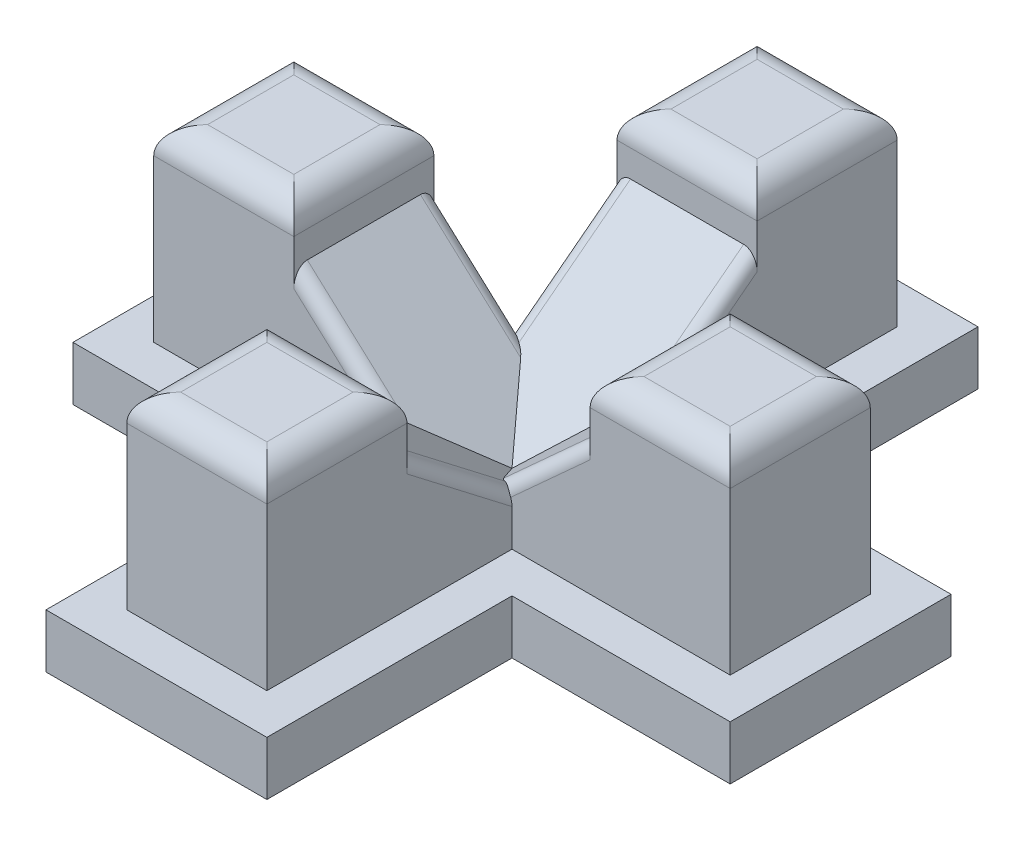
from build123d import *

# Parameters (mm, degrees)
BOSS_EXTRUDE1_DEPTH = 2
SKETCH4_W           = 5.2
SKETCH4_H           = 5.2
BOSS_EXTRUDE3_DEPTH = 7
FILLET6_R           = 1
BOSS_EXTRUDE4_DEPTH = 5.2
BOSS_EXTRUDE5_DEPTH = 5.2
BOSS_EXTRUDE6_DEPTH = 5.2
BOSS_EXTRUDE7_DEPTH = 5.2
FILLET7_R           = 0.5


with BuildPart() as part:
    # Sketch1 → Boss-Extrude1 (new body)
    with BuildSketch(Plane(origin=(0, 0, 0), x_dir=(1, 0, 0), z_dir=(0, 1, 0))):
        Polygon((-4.1, 13.2), (-4.1, 4.1), (-12.2, 4.1), (-12.2, -4.1), (-4.1, -4.1), (-4.1, -13.2), (4.1, -13.2), (4.1, -4.1), (12.2, -4.1), (12.2, 4.1), (4.1, 4.1), (4.1, 13.2), align=None)
    extrude(amount=BOSS_EXTRUDE1_DEPTH)

    # Sketch4 → Boss-Extrude3 (add)
    with BuildSketch(Plane(origin=(0, 2, 0), x_dir=(1, 0, 0), z_dir=(0, 1, 0))):
        with Locations((8.1, 0)):
            Rectangle(SKETCH4_W, SKETCH4_H)
        with Locations((0, -9.1)):
            Rectangle(SKETCH4_W, SKETCH4_H)
        with Locations((0, 9.1)):
            Rectangle(SKETCH4_W, SKETCH4_H)
        with Locations((-8.1, 0)):
            Rectangle(SKETCH4_W, SKETCH4_H)
    extrude(amount=BOSS_EXTRUDE3_DEPTH)

    # Fillet6
    fillet6_edges = [part.edges().sort_by_distance(p)[0] for p in [
        (-2.6, 9, -9.1),
        (0, 9, -11.7),
        (2.6, 9, -9.1),
        (0, 9, -6.5),
        (-5.5, 9, 0),
        (-8.1, 9, 2.6),
        (-10.7, 9, 0),
        (-8.1, 9, -2.6),
        (-2.6, 9, 9.1),
        (0, 9, 6.5),
        (2.6, 9, 9.1),
        (0, 9, 11.7),
        (8.1, 9, 2.6),
        (5.5, 9, 0),
        (10.7, 9, 0),
        (8.1, 9, -2.6),
    ]]
    fillet(fillet6_edges, radius=FILLET6_R)

    # Sketch5 → Boss-Extrude4 (add)
    with BuildSketch(Plane(origin=(0, 0, -2.6), x_dir=(-1, 0, 0), z_dir=(0, 0, -1))):
        Polygon((-5.5, 2), (-5.5, 6.997947642), (0, 2), align=None)
    extrude(amount=-BOSS_EXTRUDE4_DEPTH)

    # Sketch6 → Boss-Extrude5 (add)
    with BuildSketch(Plane(origin=(2.6, 0, 0), x_dir=(0, 0, -1), z_dir=(1, 0, 0))):
        Polygon((6.5, 2), (6.5, 7), (0, 2), align=None)
    extrude(amount=-BOSS_EXTRUDE5_DEPTH)

    # Sketch7 → Boss-Extrude6 (add)
    with BuildSketch(Plane(origin=(0, 0, -2.6), x_dir=(-1, 0, 0), z_dir=(0, 0, -1))):
        Polygon((5.5, 2), (5.5, 7), (0, 2), align=None)
    extrude(amount=-BOSS_EXTRUDE6_DEPTH)

    # Sketch8 → Boss-Extrude7 (add)
    with BuildSketch(Plane.ZY.offset(2.6)):
        Polygon((6.5, 2), (6.5, 7), (0, 2), align=None)
    extrude(amount=-BOSS_EXTRUDE7_DEPTH)

    # Fillet7
    fillet7_edges = [part.edges().sort_by_distance(p)[0] for p in [
        (2.6, 5.5, 4.55),
    ]]
    fillet(fillet7_edges, radius=FILLET7_R)
    fillet7_2_edges = [part.edges().sort_by_distance(p)[0] for p in [
        (-2.6, 5.5, 4.55),
    ]]
    fillet(fillet7_2_edges, radius=FILLET7_R)
    fillet7_3_edges = [part.edges().sort_by_distance(p)[0] for p in [
        (3.850451704, 5.498973821, -2.6),
    ]]
    fillet(fillet7_3_edges, radius=FILLET7_R)
    fillet7_4_edges = [part.edges().sort_by_distance(p)[0] for p in [
        (3.844826513, 5.49386211, 2.6),
    ]]
    fillet(fillet7_4_edges, radius=FILLET7_R)
    fillet7_5_edges = [part.edges().sort_by_distance(p)[0] for p in [
        (2.6, 5.482875985, -4.527738781),
    ]]
    fillet(fillet7_5_edges, radius=FILLET7_R)
    fillet7_6_edges = [part.edges().sort_by_distance(p)[0] for p in [
        (-2.6, 5.5, -4.55),
    ]]
    fillet(fillet7_6_edges, radius=FILLET7_R)
    fillet7_7_edges = [part.edges().sort_by_distance(p)[0] for p in [
        (-3.844467541, 5.494970492, -2.6),
    ]]
    fillet(fillet7_7_edges, radius=FILLET7_R)
    fillet7_8_edges = [part.edges().sort_by_distance(p)[0] for p in [
        (-3.844467541, 5.494970492, 2.6),
    ]]
    fillet(fillet7_8_edges, radius=FILLET7_R)


solid = part.part
